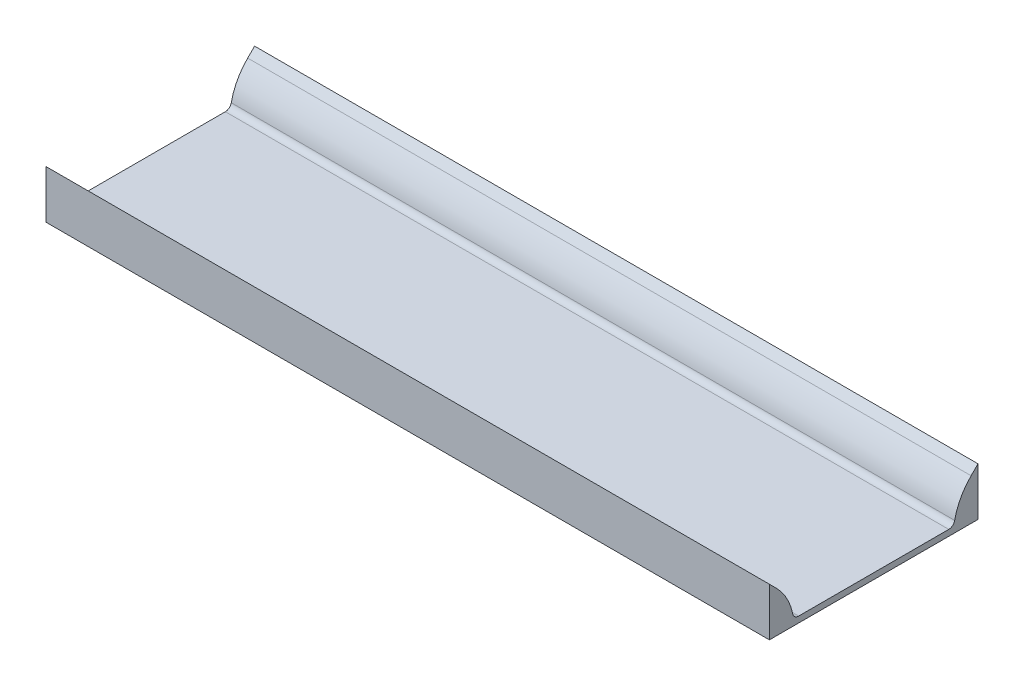
from build123d import *

# Parameters (mm, degrees)
SKETCH1_W           = 152.4
SKETCH1_H           = 43.942
BOSS_EXTRUDE1_DEPTH = 10.16
SKETCH2_W           = 139.7
SKETCH2_H           = 33.782
SKETCH2_W_2         = 6.35
CUT_EXTRUDE1_DEPTH  = 8.89
CHAMFER1_SIZE       = 5.08
FILLET1_R           = 12.7
FILLET2_R           = 1.27


# Some blends are built 0.0001 mm under size
with BuildPart() as part:
    # Sketch1 → Boss-Extrude1 (new body)
    with BuildSketch(Plane(origin=(0, 0, 0), x_dir=(1, 0, 0), z_dir=(0, 1, 0))):
        Rectangle(SKETCH1_W, SKETCH1_H)
    extrude(amount=BOSS_EXTRUDE1_DEPTH)

    # Sketch2 → Cut-Extrude1 (cut)
    with BuildSketch(Plane(origin=(0, 10.16, 0), x_dir=(1, 0, 0), z_dir=(0, 1, 0))):
        Rectangle(SKETCH2_W, SKETCH2_H)
        with Locations((73.025, 0)):
            Rectangle(SKETCH2_W_2, SKETCH2_H)
        with Locations((-73.025, 0)):
            Rectangle(SKETCH2_W_2, SKETCH2_H)
    extrude(amount=-CUT_EXTRUDE1_DEPTH, mode=Mode.SUBTRACT)

    # Chamfer1
    chamfer1_edges = [part.edges().sort_by_distance(p)[0] for p in [
        (0, 10.16, 16.891),
        (0, 10.16, -16.891),
    ]]
    chamfer(chamfer1_edges, length=CHAMFER1_SIZE - 0.0001)  # a hair under: the kernel refuses the full size

    # Fillet1
    # the kernel refuses this fillet: 12.7 mm, written as the material it takes off along each edge
    with BuildSketch(Plane(origin=(89.017910379, 5.0801, 16.891), x_dir=(0, -1, 0), z_dir=(-1, 0, 0))) as fillet1_piece_1:
        with BuildLine():
            CenterArc((5.354803581, 12.605708661), FILLET1_R, 225, 38.013804416)
            Line((-3.62545254, 3.62545254), (-3.805057662, 3.445847418))
            Line((-3.805057662, 3.445847418), (-0.179605122, -0.179605122))
            Line((-0.179605122, -0.179605122), (0, -0.254))
            ThreePointArc((0, -0.254), (1.90505, -0.254), (3.779205928, -0.252114173))
            Line((3.779205928, -0.252114173), (3.8101, 0))
        make_face()
    extrude(amount=178.035820759, mode=Mode.SUBTRACT)
    with BuildSketch(Plane(origin=(89.017910379, 5.0801, -16.891), x_dir=(0, 0.7071067811865476, -0.7071067811865476), z_dir=(-1, 0, 0))) as fillet1_piece_2:
        with BuildLine():
            CenterArc((5.127164152, 12.7), FILLET1_R, 231.986195584, 38.013804416)
            Line((-2.694147547, 2.694147547), (-2.850573781, 2.494030498))
            ThreePointArc((-2.850573781, 2.494030498), (-1.526678896, 1.167468651), (-0.179605122, -0.179605122))
            Line((-0.179605122, -0.179605122), (0, -0.254))
            Line((0, -0.254), (5.127164152, -0.254))
            Line((5.127164152, -0.254), (5.127164152, 0))
        make_face()
    extrude(amount=178.035820759, mode=Mode.SUBTRACT)

    # Fillet2
    fillet2_edges = [part.edges().sort_by_distance(p)[0] for p in [
        (0, 1.27, 16.891),
        (0, 1.27, -16.891),
    ]]
    fillet(fillet2_edges, radius=FILLET2_R)


solid = part.part
